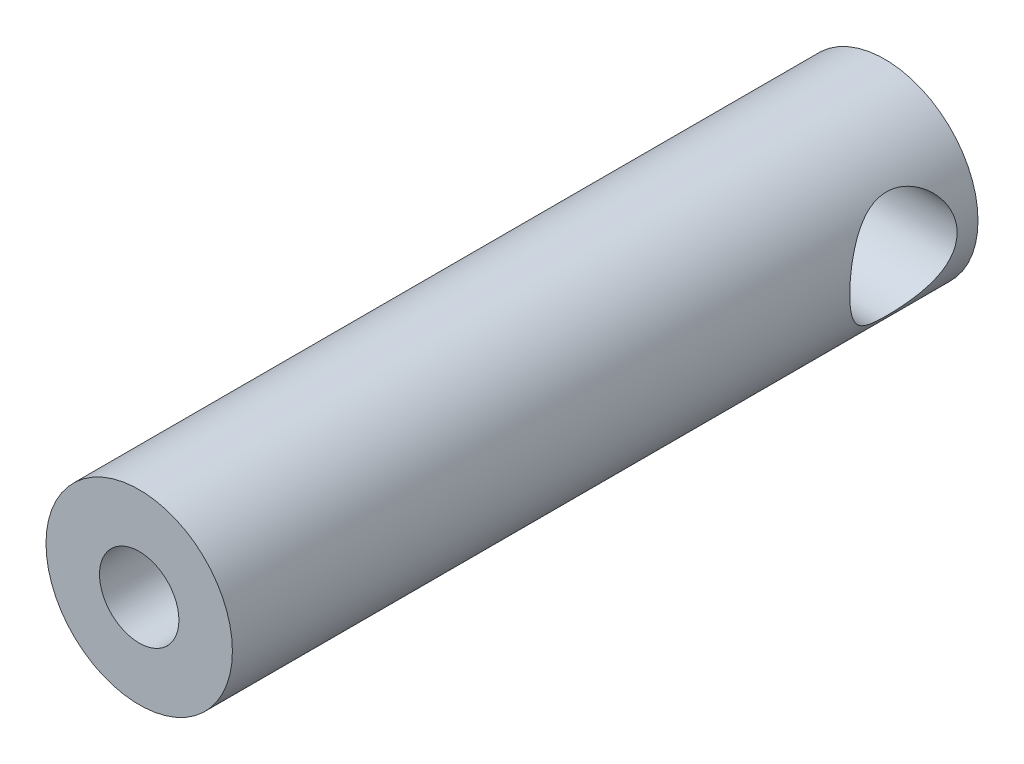
from build123d import *

# Parameters (mm, degrees)
SKETCH1_R                 = 3.175
BOSS_EXTRUDE1_DEPTH       = 25.4
CUT_EXTRUDE2_DEPTH        = 26.793821935
CUT_EXTRUDE2_DEPTH_BACK   = 26.793821935
SKETCH3_R                 = 1.8288
F_6_32_TAPPED_HOLE1_D     = 2.7051
F_6_32_TAPPED_HOLE1_DEPTH = 12.7
F_6_32_TAPPED_HOLE1_TIP   = 0.81269403


with BuildPart() as part:
    # Sketch1 → Boss-Extrude1 (new body)
    with BuildSketch(Plane.XY):
        Circle(SKETCH1_R)
    extrude(amount=BOSS_EXTRUDE1_DEPTH)

    # Sketch3 → Cut-Extrude2 (cut, two sides: drawn at the far end of the back side and taken through both)
    with BuildSketch(Plane(origin=(0, 0, 0), x_dir=(0, 0, -1), z_dir=(1, 0, 0)).offset(-CUT_EXTRUDE2_DEPTH_BACK)):
        with Locations((-2.54, 0)):
            Circle(SKETCH3_R)
    extrude(amount=CUT_EXTRUDE2_DEPTH + CUT_EXTRUDE2_DEPTH_BACK, mode=Mode.SUBTRACT)

    # #6-32 Tapped Hole1
    with Locations(Plane.XY.offset(25.4)):
        with Locations((0, 0)):
            Hole(F_6_32_TAPPED_HOLE1_D / 2, depth=F_6_32_TAPPED_HOLE1_DEPTH)
            with Locations((0, 0, -(F_6_32_TAPPED_HOLE1_DEPTH + F_6_32_TAPPED_HOLE1_TIP / 2))):  # 118° drill point
                Cone(0, F_6_32_TAPPED_HOLE1_D / 2, F_6_32_TAPPED_HOLE1_TIP, mode=Mode.SUBTRACT)


solid = part.part
